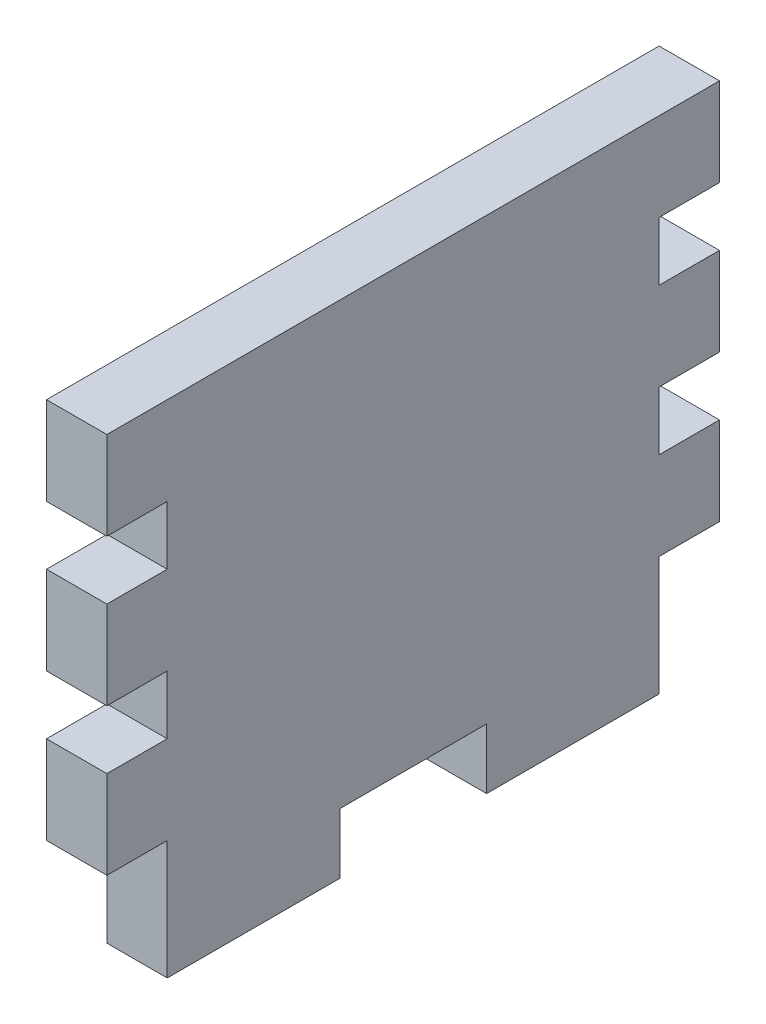
from build123d import *

# Parameters (mm, degrees)
BOSS_EXTRUDE1_DEPTH     = 4.11
PADDLE_MASTER_START     = 16.75
PADDLE_MASTER_OUTLINE_W = 4.11
PADDLE_MASTER_OUTLINE_H = 4.11
PADDLE_MASTER_DEPTH     = 10


# Read off the part's stored shape, not the designer's step: paddle_master
with BuildPart() as part:
    # motor_support_side-paddle_master<2> → Boss-Extrude1 (new body)
    with BuildSketch(Plane(origin=(15.26, -123.833512511, 38.5), x_dir=(0, 0, -1), z_dir=(1, 0, 0))):
        Polygon((33.5, 34.11), (0, 34.11), (-4.11, 34.11), (-4.11, 28.11), (0, 28.11), (0, 24.11), (-4.11, 24.11), (-4.11, 18.11), (0, 18.11), (0, 14.11), (-4.11, 14.11), (-4.11, 8.11), (0, 8.11), (0, 0), (33.5, 0), (33.5, 8.11), (37.61, 8.11), (37.61, 14.11), (33.5, 14.11), (33.5, 18.11), (37.61, 18.11), (37.61, 24.11), (33.5, 24.11), (33.5, 28.11), (37.61, 28.11), (37.61, 34.11), align=None)
    extrude(amount=-BOSS_EXTRUDE1_DEPTH)

    # paddle_master outline → paddle_master (cut)
    with BuildSketch(Plane.XY.offset(PADDLE_MASTER_START)):
        with Locations((13.205, -121.778512511)):
            Rectangle(PADDLE_MASTER_OUTLINE_W, PADDLE_MASTER_OUTLINE_H)
    extrude(amount=PADDLE_MASTER_DEPTH, mode=Mode.SUBTRACT)


solid = part.part
